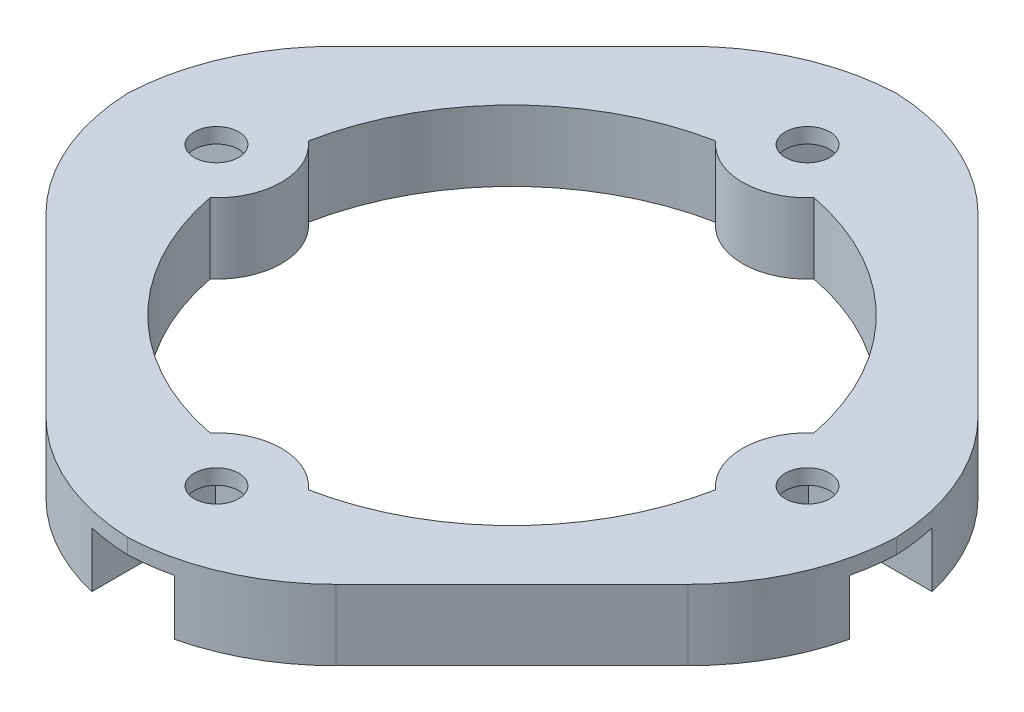
from build123d import *

# Parameters (mm, degrees)
SKETCH1_R           = 72.5
SKETCH1_R_2         = 47.5
BOSS_EXTRUDE1_DEPTH = 13
SKETCH2_R           = 4.1
CUT_EXTRUDE1_DEPTH  = 104.351342517
SKETCH8_R           = 12
SKETCH8_R_2         = 4.1
BOSS_EXTRUDE4_DEPTH = 13
SKETCH3_W           = 15.2
SKETCH3_H           = 40
SKETCH3_W_2         = 40
SKETCH3_H_2         = 15.2
CUT_EXTRUDE2_DEPTH  = 10.2
BOSS_EXTRUDE2_DEPTH = 13
FILLET1_R           = 30
SKETCH7_OUTSIDE_W   = 188.094
SKETCH7_OUTSIDE_H   = 188.094
CUT_EXTRUDE4_DEPTH  = 104.351342517
FILLET3_R           = 40


with BuildPart() as part:
    # Sketch1 → Boss-Extrude1 (new body)
    with BuildSketch(Plane(origin=(0, 0, 0), x_dir=(1, 0, 0), z_dir=(0, 1, 0))):
        with Locations(Location((0, 0, 0), (0, 0, 90))):
            Circle(SKETCH1_R)
        with Locations(Location((0, 0, 0), (0, 0, 90))):
            Circle(SKETCH1_R_2, mode=Mode.SUBTRACT)
    extrude(amount=BOSS_EXTRUDE1_DEPTH)

    # Sketch2 → Cut-Extrude1 (cut, through all)
    with BuildSketch(Plane(origin=(0, 13, 0), x_dir=(1, 0, 0), z_dir=(0, 1, 0))):
        with Locations(Location((0, 54.5, 0), (0, 0, 270))):
            Circle(SKETCH2_R)
        with Locations(Location((54.5, 0, 0), (0, 0, 270))):
            Circle(SKETCH2_R)
        with Locations(Location((0, -54.5, 0), (0, 0, 270))):
            Circle(SKETCH2_R)
        with Locations(Location((-54.5, 0, 0), (0, 0, 270))):
            Circle(SKETCH2_R)
    extrude(amount=-CUT_EXTRUDE1_DEPTH, mode=Mode.SUBTRACT)

    # Sketch8 → Boss-Extrude4 (add)
    # profile 1 of 4: a face of its own
    with BuildSketch(Plane(origin=(0, 13, 0), x_dir=(1, 0, 0), z_dir=(0, 1, 0))):
        with Locations((54.5, 0)):
            Circle(SKETCH8_R)
        with Locations(Location((54.5, 0, 0), (0, 0, 270))):
            Circle(SKETCH8_R_2, mode=Mode.SUBTRACT)
    # profile 2 of 4: a face of its own
    with BuildSketch(Plane(origin=(0, 13, 0), x_dir=(1, 0, 0), z_dir=(0, 1, 0))):
        with Locations((0, -54.5)):
            Circle(SKETCH8_R)
        with Locations(Location((0, -54.5, 0), (0, 0, 270))):
            Circle(SKETCH8_R_2, mode=Mode.SUBTRACT)
    # profile 3 of 4: a face of its own
    with BuildSketch(Plane(origin=(0, 13, 0), x_dir=(1, 0, 0), z_dir=(0, 1, 0))):
        with Locations((-54.5, 0)):
            Circle(SKETCH8_R)
        with Locations(Location((-54.5, 0, 0), (0, 0, 270))):
            Circle(SKETCH8_R_2, mode=Mode.SUBTRACT)
    # profile 4 of 4: a face of its own
    with BuildSketch(Plane(origin=(0, 13, 0), x_dir=(1, 0, 0), z_dir=(0, 1, 0))):
        with Locations((0, 54.5)):
            Circle(SKETCH8_R)
        with Locations(Location((0, 54.5, 0), (0, 0, 270))):
            Circle(SKETCH8_R_2, mode=Mode.SUBTRACT)
    extrude(amount=-BOSS_EXTRUDE4_DEPTH)

    # Sketch3 → Cut-Extrude2 (cut)
    with BuildSketch(Plane.XZ):
        with Locations((0, 67.1)):
            Rectangle(SKETCH3_W, SKETCH3_H)
        with Locations((67.1, 0)):
            Rectangle(SKETCH3_W_2, SKETCH3_H_2)
        with Locations((0, -67.1)):
            Rectangle(SKETCH3_W, SKETCH3_H)
        with Locations((-67.1, 0)):
            Rectangle(SKETCH3_W_2, SKETCH3_H_2)
    extrude(amount=-CUT_EXTRUDE2_DEPTH, mode=Mode.SUBTRACT)

    # Sketch4 → Boss-Extrude2 (add)
    with BuildSketch(Plane(origin=(0, 13, 0), x_dir=(1, 0, 0), z_dir=(0, 1, 0))):
        Polygon((-38.890872965, -63.639610307), (-63.639610307, -38.890872965), (-62.123740526, -37.375003185), (-37.375003185, -62.123740526), align=None)
    extrude(amount=-BOSS_EXTRUDE2_DEPTH)

    # Fillet1
    # the kernel refuses this fillet: 30 mm, written as the material it adds along each edge
    with BuildSketch(Plane(origin=(-62.123740526, 13, 37.375003185), x_dir=(-0.46376459281913895, 0, -0.8859584654188357), z_dir=(0, -1, 0))) as fillet1_piece_1:
        with BuildLine():
            CenterArc((10.383918848, -29.947140809), FILLET1_R, 93.401739444, 18.157539937)
            Line((-0.639990933, -2.046004396), (-0.860469129, -1.487981668))
            ThreePointArc((-0.860469129, -1.487981668), (-0.892634463, -0.843880508), (-0.572638996, 0.17912169))
            Line((-0.572638996, 0.17912169), (0.035602007, 0.598942816))
            ThreePointArc((0.035602007, 0.598942816), (4.301909237, 0.472256956), (8.568216466, 0.598942816))
            Line((8.568216466, 0.598942816), (8.603818474, 0))
        make_face()
    extrude(amount=13)
    with BuildSketch(Plane(origin=(-37.375003185, 13, 62.123740526), x_dir=(0.8859584654188359, 0, 0.4637645928191383), z_dir=(0, -1, 0))) as fillet1_piece_2:
        with BuildLine():
            CenterArc((10.383918848, 29.947140809), FILLET1_R, 248.440720619, 18.157539937)
            Line((-0.639990933, 2.046004396), (-0.860469129, 1.487981668))
            ThreePointArc((-0.860469129, 1.487981668), (-0.892634463, 0.843880508), (-0.572638996, -0.17912169))
            Line((-0.572638996, -0.17912169), (0.035602007, -0.598942816))
            ThreePointArc((0.035602007, -0.598942816), (4.301909237, -0.472256956), (8.568216466, -0.598942816))
            Line((8.568216466, -0.598942816), (8.603818474, 0))
        make_face()
    extrude(amount=13)

    # Sketch7 outside → Cut-Extrude4 (cut, through all)
    with BuildSketch(Plane(origin=(0, 13, 0), x_dir=(1, 0, 0), z_dir=(0, 1, 0))):
        Rectangle(SKETCH7_OUTSIDE_W, SKETCH7_OUTSIDE_H)
        Polygon((70.931304796, -15), (15, -70.931304796), (-15, -70.931304796), (-70.931304796, -15), (-70.931304796, 15), (-15, 70.931304796), (15, 70.931304796), (70.931304796, 15), align=None, mode=Mode.SUBTRACT)
    extrude(amount=-CUT_EXTRUDE4_DEPTH, mode=Mode.SUBTRACT)

    # Fillet3
    # the kernel refuses this fillet: 40 mm, written as the material it takes off along each edge
    with BuildSketch(Plane(origin=(15, 54.421356237, 70.931304796), x_dir=(-1, 0, 0), z_dir=(0, -1, 0)), Plane(origin=(70.931304796, 54.421356237, 15), x_dir=(-0.7071067811865474, 0, 0.7071067811865476), z_dir=(0, -1, 0))) as fillet3_piece_1:
        with BuildLine():
            CenterArc((FILLET3_R * 0.414213562373, FILLET3_R), FILLET3_R, 225, 45)
            Line((-FILLET3_R * 0.292893218813, FILLET3_R * 0.292893218813), (0, 0))
            Line((0, 0), (FILLET3_R * 0.414213562373, 0))
        make_face()
    extrude(amount=95.842712475, mode=Mode.SUBTRACT)
    with BuildSketch(Plane(origin=(-15, 54.421356237, 70.931304796), x_dir=(1, 0, 0), z_dir=(0, -1, 0)), Plane(origin=(-70.931304796, 54.421356237, 15), x_dir=(0.7071067811865476, 0, 0.7071067811865476), z_dir=(0, -1, 0)), Plane(origin=(-70.931304796, 54.421356237, -15), x_dir=(0, 0, 1), z_dir=(0, -1, 0)), Plane(origin=(-15, 54.421356237, -70.931304796), x_dir=(-0.7071067811865476, 0, 0.7071067811865476), z_dir=(0, -1, 0)), Plane(origin=(15, 54.421356237, -70.931304796), x_dir=(-1, 0, 0), z_dir=(0, -1, 0)), Plane(origin=(70.931304796, 54.421356237, -15), x_dir=(-0.7071067811865476, 0, -0.7071067811865476), z_dir=(0, -1, 0))) as fillet3_piece_2:
        with BuildLine():
            CenterArc((FILLET3_R * 0.414213562373, -FILLET3_R), FILLET3_R, 90, 45)
            Line((-FILLET3_R * 0.292893218813, -FILLET3_R * 0.292893218813), (0, 0))
            Line((0, 0), (FILLET3_R * 0.414213562373, 0))
        make_face()
    extrude(amount=95.842712475, mode=Mode.SUBTRACT)


solid = part.part
